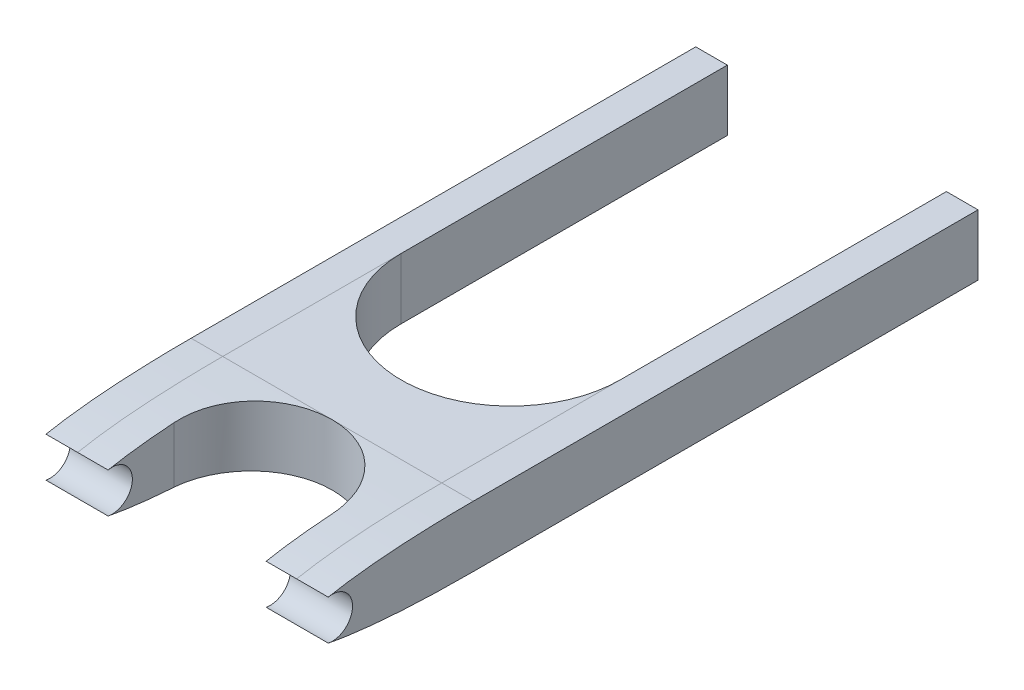
from build123d import *

# Parameters (mm, degrees)
POWIERZCHNIA_PO_CZ2_START   = -125
POWIERZCHNIA_PO_CZ2_DEPTH   = 125
POWIERZCHNIA_PO_CZ2_START_2 = -27
POWIERZCHNIA_PO_CZ2_2_DEPTH = 54
SZKIC4_R                    = 18
WYTNIJ_WYCI_GNI_CIE1_DEPTH  = 625.830377118


with BuildPart() as part:
    # Powierzchnia-Połącz2: read off the stored shape, not the designer's step
    # Powierzchnia-Połącz2 outline → Powierzchnia-Połącz2 (new body)
    with BuildSketch(Plane.YZ.offset(POWIERZCHNIA_PO_CZ2_START)):
        with BuildLine():
            add(Edge.make_bspline(
                [(-27, -125), (-27, -65.312641889), (-22.885580179, -22.821723351), (-17.654979183, 3.50737937)],
                knots=[0, 0, 0, 0, 1, 1, 1, 1], degree=3))
            Line((-27, -125), (-27, -572))
            Line((-27, -572), (27, -572))
            Line((27, -572), (27, -125))
            add(Edge.make_bspline(
                [(17.654979183, 3.50737937), (22.885580179, -22.821723351), (27, -65.312641889), (27, -125)],
                knots=[0, 0, 0, 0, 1, 1, 1, 1], degree=3))
            ThreePointArc((17.654979183, 3.50737937), (0, 18), (-17.654979183, 3.50737937))
        make_face()
    extrude(amount=POWIERZCHNIA_PO_CZ2_DEPTH)

    # Powierzchnia-Po_cz2 2 outline → Powierzchnia-Po_cz2 2 (cut)
    with BuildSketch(Plane(origin=(0, 0, 0), x_dir=(1, 0, 0), z_dir=(0, 1, 0)).offset(POWIERZCHNIA_PO_CZ2_START_2)):
        with BuildLine():
            Line((-70, 55), (-70, -20))
            Line((-70, -20), (0, -20))
            Line((0, -20), (0, 125))
            ThreePointArc((0, 125), (-49.497474683, 104.497474683), (-70, 55))
        make_face()
        with BuildLine():
            ThreePointArc((-97, 283), (-68.589357775, 214.410642225), (0, 186))
            Line((0, 186), (0, 572))
            Line((0, 572), (-97, 572))
            Line((-97, 572), (-97, 283))
        make_face()
    extrude(amount=POWIERZCHNIA_PO_CZ2_2_DEPTH, mode=Mode.SUBTRACT)

    # Lustro1: part across plane


with BuildPart() as part_1:
    add(part.part)
    add(part.part.mirror(Plane(origin=(0, 0, 0), x_dir=(0, 0, 1), z_dir=(1, 0, 0))))

    # Szkic4 → Wytnij-wyciągnięcie1 (cut, through all)
    with BuildSketch(Plane(origin=(-125, 0, 0), x_dir=(0, 0, -1), z_dir=(1, 0, 0))):
        Circle(SZKIC4_R)
    extrude(amount=WYTNIJ_WYCI_GNI_CIE1_DEPTH, mode=Mode.SUBTRACT)


solid = part_1.part
